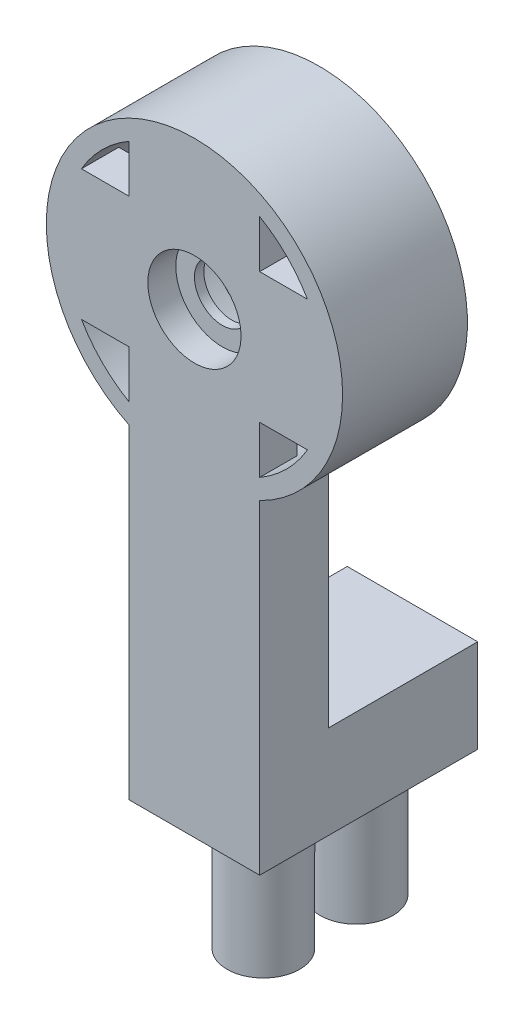
from build123d import *
from build123d.topology import SkipClean

# Parameters (mm, degrees)
SKETCH1_R            = 1.5
BOSS_EXTRUDE4_DEPTH  = 3
BOSS_EXTRUDE5_START  = 3
SKETCH3_R            = 7.95
SKETCH3_R_2          = 1.5
BOSS_EXTRUDE5_DEPTH  = 3
SKETCH4_R            = 2.5
CUT_EXTRUDE1_DEPTH   = 1.5
SKETCH5_R            = 7
CUT_EXTRUDE2_DEPTH   = 4
SKETCH6_R            = 7.95
CUT_EXTRUDE3_DEPTH   = 1
SKETCH7_R            = 2.5
CUT_EXTRUDE4_DEPTH   = 0.5
BOSS_EXTRUDE6_START  = 0.7
SKETCH8_R            = 7.95
SKETCH8_R_2          = 7
BOSS_EXTRUDE6_DEPTH  = 0.7
BOSS_EXTRUDE8_START  = 0.7
SKETCH9_R            = 7.95
SKETCH9_R_2          = 1.5
BOSS_EXTRUDE8_DEPTH  = 0.7
BOSS_EXTRUDE9_START  = 0.7
BOSS_EXTRUDE9_DEPTH  = 0.7
SKETCH15_R           = 7
SKETCH15_R_2         = 4.949747468
BOSS_EXTRUDE12_DEPTH = 5.7
SKETCH16_W           = 7
SKETCH16_H           = 7
CUT_EXTRUDE7_DEPTH   = 5.7
SKETCH17_W           = 21.103619628
SKETCH17_H           = 19.457314619
CUT_EXTRUDE8_DEPTH   = 10
SKETCH18_W           = 7
SKETCH18_H           = 8
BOSS_EXTRUDE13_DEPTH = 5
SKETCH19_R           = 1.95
BOSS_EXTRUDE14_DEPTH = 7


with BuildPart() as part:
    # Sketch1 → Boss-Extrude4 (new body)
    with BuildSketch(Plane.XY):
        with BuildLine():
            Line((-3.5, -7.138101989), (-3.5, -27.861898011))
            ThreePointArc((-3.5, -27.861898011), (0, -42.95), (3.5, -27.861898011))
            Line((3.5, -27.861898011), (3.5, -7.138101989))
            ThreePointArc((3.5, -7.138101989), (0, 7.95), (-3.5, -7.138101989))
        make_face()
        with BuildLine():
            Line((-3.5, 6.062177826), (-3.5, 3.5))
            Line((-3.5, 3.5), (-6.062177826, 3.5))
            ThreePointArc((-6.062177826, 3.5), (-4.949747468, 4.949747468), (-3.5, 6.062177826))
        make_face(mode=Mode.SUBTRACT)
        with BuildLine():
            Line((3.5, 3.5), (3.5, 6.062177826))
            ThreePointArc((3.5, 6.062177826), (4.949747468, 4.949747468), (6.062177826, 3.5))
            Line((6.062177826, 3.5), (3.5, 3.5))
        make_face(mode=Mode.SUBTRACT)
        Circle(SKETCH1_R, mode=Mode.SUBTRACT)
        with BuildLine():
            Line((-6.062177826, -3.5), (-3.5, -3.5))
            Line((-3.5, -3.5), (-3.5, -6.062177826))
            ThreePointArc((-3.5, -6.062177826), (-4.949747468, -4.949747468), (-6.062177826, -3.5))
        make_face(mode=Mode.SUBTRACT)
        with BuildLine():
            Line((3.5, -3.5), (6.062177826, -3.5))
            ThreePointArc((6.062177826, -3.5), (4.949747468, -4.949747468), (3.5, -6.062177826))
            Line((3.5, -6.062177826), (3.5, -3.5))
        make_face(mode=Mode.SUBTRACT)
        with BuildLine():
            ThreePointArc((3.5, -28.937822174), (4.949747468, -30.050252532), (6.062177826, -31.5))
            Line((6.062177826, -31.5), (3.5, -31.5))
            Line((3.5, -31.5), (3.5, -28.937822174))
        make_face(mode=Mode.SUBTRACT)
        with BuildLine():
            Line((-3.5, -28.937822174), (-3.5, -31.5))
            Line((-3.5, -31.5), (-6.062177826, -31.5))
            ThreePointArc((-6.062177826, -31.5), (-4.949747468, -30.050252532), (-3.5, -28.937822174))
        make_face(mode=Mode.SUBTRACT)
        with BuildLine():
            ThreePointArc((-3.5, -41.062177826), (-4.949747468, -39.949747468), (-6.062177826, -38.5))
            Line((-6.062177826, -38.5), (-3.5, -38.5))
            Line((-3.5, -38.5), (-3.5, -41.062177826))
        make_face(mode=Mode.SUBTRACT)
        with BuildLine():
            ThreePointArc((6.062177826, -38.5), (4.949747468, -39.949747468), (3.5, -41.062177826))
            Line((3.5, -41.062177826), (3.5, -38.5))
            Line((3.5, -38.5), (6.062177826, -38.5))
        make_face(mode=Mode.SUBTRACT)
        with Locations((0, -35)):
            Circle(SKETCH1_R, mode=Mode.SUBTRACT)
    extrude(amount=BOSS_EXTRUDE4_DEPTH)

    # Sketch3 → Boss-Extrude5 (add)
    # profile 1 of 2: a face of its own
    with SkipClean():  # the faces are left unmerged after this step: merging them gives an invalid solid
        with BuildSketch(Plane(origin=(0, 0, 0), x_dir=(-1, 0, 0), z_dir=(0, 0, -1)).offset(BOSS_EXTRUDE5_START)):
            Circle(SKETCH3_R)
            with BuildLine():
                Line((3.5, 3.5), (3.5, 6.062177826))
                ThreePointArc((3.5, 6.062177826), (4.949747468, 4.949747468), (6.062177826, 3.5))
                Line((6.062177826, 3.5), (3.5, 3.5))
            make_face(mode=Mode.SUBTRACT)
            with BuildLine():
                Line((3.5, -3.5), (6.062177826, -3.5))
                ThreePointArc((6.062177826, -3.5), (4.949747468, -4.949747468), (3.5, -6.062177826))
                Line((3.5, -6.062177826), (3.5, -3.5))
            make_face(mode=Mode.SUBTRACT)
            with BuildLine():
                Line((-3.5, -3.5), (-3.5, -6.062177826))
                ThreePointArc((-3.5, -6.062177826), (-4.949747468, -4.949747468), (-6.062177826, -3.5))
                Line((-6.062177826, -3.5), (-3.5, -3.5))
            make_face(mode=Mode.SUBTRACT)
            with BuildLine():
                Line((-3.5, 3.5), (-6.062177826, 3.5))
                ThreePointArc((-6.062177826, 3.5), (-4.949747468, 4.949747468), (-3.5, 6.062177826))
                Line((-3.5, 6.062177826), (-3.5, 3.5))
            make_face(mode=Mode.SUBTRACT)
            Circle(SKETCH3_R_2, mode=Mode.SUBTRACT)
        # profile 2 of 2: a face of its own
        with BuildSketch(Plane(origin=(0, 0, 0), x_dir=(-1, 0, 0), z_dir=(0, 0, -1)).offset(BOSS_EXTRUDE5_START)):
            with Locations((0, -35)):
                Circle(SKETCH3_R)
            with BuildLine():
                Line((-3.5, -38.5), (-3.5, -41.062177826))
                ThreePointArc((-3.5, -41.062177826), (-4.949747468, -39.949747468), (-6.062177826, -38.5))
                Line((-6.062177826, -38.5), (-3.5, -38.5))
            make_face(mode=Mode.SUBTRACT)
            with BuildLine():
                Line((-3.5, -31.5), (-6.062177826, -31.5))
                ThreePointArc((-6.062177826, -31.5), (-4.949747468, -30.050252532), (-3.5, -28.937822174))
                Line((-3.5, -28.937822174), (-3.5, -31.5))
            make_face(mode=Mode.SUBTRACT)
            with BuildLine():
                Line((3.5, -31.5), (3.5, -28.937822174))
                ThreePointArc((3.5, -28.937822174), (4.949747468, -30.050252532), (6.062177826, -31.5))
                Line((6.062177826, -31.5), (3.5, -31.5))
            make_face(mode=Mode.SUBTRACT)
            with BuildLine():
                Line((3.5, -38.5), (6.062177826, -38.5))
                ThreePointArc((6.062177826, -38.5), (4.949747468, -39.949747468), (3.5, -41.062177826))
                Line((3.5, -41.062177826), (3.5, -38.5))
            make_face(mode=Mode.SUBTRACT)
            with Locations((0, -35)):
                Circle(SKETCH3_R_2, mode=Mode.SUBTRACT)
        extrude(amount=-BOSS_EXTRUDE5_DEPTH)

    # Sketch4 → Cut-Extrude1 (cut)
    with SkipClean():  # the faces are left unmerged after this step: merging them gives an invalid solid
        with BuildSketch(Plane.XY.offset(3)):
            with Locations((0, -35)):
                Circle(SKETCH4_R)
            Circle(SKETCH4_R)
        extrude(amount=-CUT_EXTRUDE1_DEPTH, mode=Mode.SUBTRACT)

    # Sketch5 → Cut-Extrude2 (cut)
    with SkipClean():  # the faces are left unmerged after this step: merging them gives an invalid solid
        with BuildSketch(Plane(origin=(0, 0, -3), x_dir=(-1, 0, 0), z_dir=(0, 0, -1))):
            Circle(SKETCH5_R)
        extrude(amount=-CUT_EXTRUDE2_DEPTH, mode=Mode.SUBTRACT)
    add(part.part.scale(1), mode=Mode.REPLACE)  # the faces are merged on a copy

    # Sketch6 → Cut-Extrude3 (cut)
    with BuildSketch(Plane(origin=(0, 0, -3), x_dir=(-1, 0, 0), z_dir=(0, 0, -1))):
        with Locations((0, -35)):
            Circle(SKETCH6_R)
    extrude(amount=-CUT_EXTRUDE3_DEPTH, mode=Mode.SUBTRACT)

    # Sketch7 → Cut-Extrude4 (cut)
    with BuildSketch(Plane.XY.offset(1.5)):
        with Locations((0, -35)):
            Circle(SKETCH7_R)
    extrude(amount=-CUT_EXTRUDE4_DEPTH, mode=Mode.SUBTRACT)

    # Sketch8 → Boss-Extrude6 (add)
    with BuildSketch(Plane(origin=(0, 0, -3), x_dir=(-1, 0, 0), z_dir=(0, 0, -1)).offset(BOSS_EXTRUDE6_START)):
        Circle(SKETCH8_R)
        Circle(SKETCH8_R_2, mode=Mode.SUBTRACT)
    extrude(amount=-BOSS_EXTRUDE6_DEPTH)

    # Sketch9 → Boss-Extrude8 (add)
    with SkipClean():  # the faces are left unmerged after this step: merging them gives an invalid solid
        with BuildSketch(Plane(origin=(0, 0, -2), x_dir=(-1, 0, 0), z_dir=(0, 0, -1)).offset(BOSS_EXTRUDE8_START)):
            with Locations((0, -35)):
                Circle(SKETCH9_R)
            with BuildLine():
                Line((3.5, -31.5), (3.5, -28.937822174))
                ThreePointArc((3.5, -28.937822174), (4.949747468, -30.050252532), (6.062177826, -31.5))
                Line((6.062177826, -31.5), (3.5, -31.5))
            make_face(mode=Mode.SUBTRACT)
            with BuildLine():
                Line((3.5, -38.5), (6.062177826, -38.5))
                ThreePointArc((6.062177826, -38.5), (4.949747468, -39.949747468), (3.5, -41.062177826))
                Line((3.5, -41.062177826), (3.5, -38.5))
            make_face(mode=Mode.SUBTRACT)
            with BuildLine():
                Line((-3.5, -38.5), (-3.5, -41.062177826))
                ThreePointArc((-3.5, -41.062177826), (-4.949747468, -39.949747468), (-6.062177826, -38.5))
                Line((-6.062177826, -38.5), (-3.5, -38.5))
            make_face(mode=Mode.SUBTRACT)
            with BuildLine():
                Line((-3.5, -31.5), (-6.062177826, -31.5))
                ThreePointArc((-6.062177826, -31.5), (-4.949747468, -30.050252532), (-3.5, -28.937822174))
                Line((-3.5, -28.937822174), (-3.5, -31.5))
            make_face(mode=Mode.SUBTRACT)
            with Locations((0, -35)):
                Circle(SKETCH9_R_2, mode=Mode.SUBTRACT)
        extrude(amount=-BOSS_EXTRUDE8_DEPTH)

    # Sketch10 → Boss-Extrude9 (add)
    with SkipClean():  # the faces are left unmerged after this step: merging them gives an invalid solid
        with BuildSketch(Plane(origin=(0, 0, 0), x_dir=(-1, 0, 0), z_dir=(0, 0, -1)).offset(BOSS_EXTRUDE9_START)):
            with BuildLine():
                ThreePointArc((3.5, -7.138101989), (0, -7.95), (-3.5, -7.138101989))
                Line((-3.5, -7.138101989), (-3.5, -27.861898011))
                ThreePointArc((-3.5, -27.861898011), (0, -27.05), (3.5, -27.861898011))
                Line((3.5, -27.861898011), (3.5, -7.138101989))
            make_face()
        extrude(amount=-BOSS_EXTRUDE9_DEPTH)

    # Sketch15 → Boss-Extrude12 (add)
    with SkipClean():  # the faces are left unmerged after this step: merging them gives an invalid solid
        with BuildSketch(Plane(origin=(0, 0, -2.7), x_dir=(-1, 0, 0), z_dir=(0, 0, -1))):
            with Locations((0, -35)):
                Circle(SKETCH15_R)
            with Locations((0, -35)):
                Circle(SKETCH15_R_2, mode=Mode.SUBTRACT)
        extrude(amount=-BOSS_EXTRUDE12_DEPTH)

    # Sketch16 → Cut-Extrude7 (cut)
    with SkipClean():  # the faces are left unmerged after this step: merging them gives an invalid solid
        with BuildSketch(Plane(origin=(0, 0, -2.7), x_dir=(-1, 0, 0), z_dir=(0, 0, -1))):
            with Locations((0, -35)):
                Rectangle(SKETCH16_W, SKETCH16_H)
        extrude(amount=-CUT_EXTRUDE7_DEPTH, mode=Mode.SUBTRACT)

    # Sketch17 → Cut-Extrude8 (cut)
    with SkipClean():  # the faces are left unmerged after this step: merging them gives an invalid solid
        with BuildSketch(Plane(origin=(0, 0, -2.7), x_dir=(-1, 0, 0), z_dir=(0, 0, -1))):
            with Locations((-0.474648884, -34.27865731)):
                Rectangle(SKETCH17_W, SKETCH17_H)
        extrude(amount=-CUT_EXTRUDE8_DEPTH, mode=Mode.SUBTRACT)

    # Sketch18 → Boss-Extrude13 (add)
    with SkipClean():  # the faces are left unmerged after this step: merging them gives an invalid solid
        with BuildSketch(Plane.XZ.offset(24.55)):
            with Locations((0, -4.7)):
                Rectangle(SKETCH18_W, SKETCH18_H)
        extrude(amount=-BOSS_EXTRUDE13_DEPTH)

    # Sketch19 → Boss-Extrude14 (add)
    with SkipClean():  # the faces are left unmerged after this step: merging them gives an invalid solid
        with BuildSketch(Plane.XZ.offset(24.55)):
            with Locations((0, -5.7)):
                Circle(SKETCH19_R)
            with Locations((0, -0.7)):
                Circle(SKETCH19_R)
        extrude(amount=BOSS_EXTRUDE14_DEPTH)


solid = part.part
